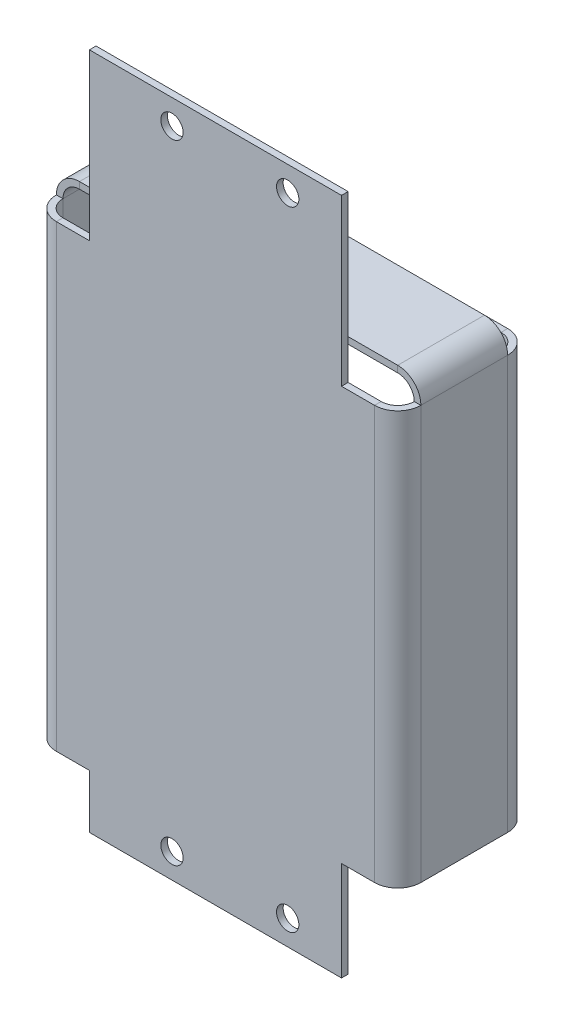
from build123d import *

# Parameters (mm, degrees)
SKETCH1_R                      = 1.35
BASE_FLANGE1_DEPTH             = 0.8
EDGE_FLANGE1_STRIP_W           = 7.2
EDGE_FLANGE1_STRIP_H           = 0.8
EDGE_FLANGE1_STRIP_CUT_DEPTH   = 50
EDGE_FLANGE1_STRIP_2_W         = 7.2
EDGE_FLANGE1_STRIP_2_H         = 0.8
EDGE_FLANGE1_STRIP_CUT_2_DEPTH = 55.5
EDGE_FLANGE1_DEPTH             = 50
EDGE_FLANGE1_BEND_DEPTH        = 55.5
EDGE_FLANGE4_DEPTH             = 10.5
EDGE_FLANGE4_BEND_DEPTH        = 10.5
EDGE_FLANGE5_DEPTH             = 50
EDGE_FLANGE5_BEND_DEPTH        = 55.5


# Sheet-metal steps are written as plain solids
with BuildPart() as part:
    # Sketch1 → Base-Flange1 (new body)
    with BuildSketch(Plane.XY):
        Polygon((15.25, 0), (15.25, -12), (-15.25, -12), (-15.25, -5.5), (-21.25, -5.5), (-21.25, 50), (-15.25, 50), (-15.25, 70), (15.25, 70), (15.25, 50), (21.25, 50), (21.25, 0), align=None)
        with Locations((8.737756115, -9)):
            Circle(SKETCH1_R, mode=Mode.SUBTRACT)
        with Locations((-5.262243885, -9)):
            Circle(SKETCH1_R, mode=Mode.SUBTRACT)
        with Locations((8.737756115, 67)):
            Circle(SKETCH1_R, mode=Mode.SUBTRACT)
        with Locations((-5.262243885, 67)):
            Circle(SKETCH1_R, mode=Mode.SUBTRACT)
    extrude(amount=BASE_FLANGE1_DEPTH)

    # Edge-Flange1 strip (across the edge) → Edge-Flange1 strip cut (cut)
    with BuildSketch(Plane(origin=(21.25, 50, 0), x_dir=(-1, 0, 0), z_dir=(0, -1, 0))):
        with Locations((-1.6, -0.4)):
            Rectangle(EDGE_FLANGE1_STRIP_W, EDGE_FLANGE1_STRIP_H)
    extrude(amount=EDGE_FLANGE1_STRIP_CUT_DEPTH, mode=Mode.SUBTRACT)

    # Edge-Flange1 strip 2 (across the edge) → Edge-Flange1 strip cut 2 (cut)
    with BuildSketch(Plane(origin=(-21.25, -5.5, 0), x_dir=(1, 0, 0), z_dir=(0, 1, 0))):
        with Locations((-1.6, -0.4)):
            Rectangle(EDGE_FLANGE1_STRIP_2_W, EDGE_FLANGE1_STRIP_2_H)
    extrude(amount=EDGE_FLANGE1_STRIP_CUT_2_DEPTH, mode=Mode.SUBTRACT)

    # Edge-Flange1 section (across the edge) → Edge-Flange1 (add)
    with BuildSketch(Plane(origin=(21.25, 50, 0), x_dir=(-1, 0, 0), z_dir=(0, -1, 0))):
        with BuildLine():
            Line((-0.8, 2), (-0.8, 12.5))
            Line((-0.8, 12.5), (0, 12.5))
            Line((0, 12.5), (0, 2))
            ThreePointArc((0, 2), (0.585786438, 0.585786438), (2, 0))
            Line((2, 0), (2, -0.8))
            ThreePointArc((2, -0.8), (0.020101013, 0.020101013), (-0.8, 2))
        make_face()
    extrude(amount=EDGE_FLANGE1_DEPTH)

    # Edge-Flange1 section 2 (across the edge) → Edge-Flange1 bend (add)
    with BuildSketch(Plane(origin=(-21.25, -5.5, 0), x_dir=(1, 0, 0), z_dir=(0, 1, 0))):
        with BuildLine():
            Line((-0.8, 2), (-0.8, 12.5))
            Line((-0.8, 12.5), (0, 12.5))
            Line((0, 12.5), (0, 2))
            ThreePointArc((0, 2), (0.585786438, 0.585786438), (2, 0))
            Line((2, 0), (2, -0.8))
            ThreePointArc((2, -0.8), (0.020101013, 0.020101013), (-0.8, 2))
        make_face()
    extrude(amount=EDGE_FLANGE1_BEND_DEPTH)

    # Edge-Flange4 section (across the edge) → Edge-Flange4 (add)
    with BuildSketch(Plane(origin=(21.25, 52, -2), x_dir=(0, -1, 0), z_dir=(0, 0, -1))):
        with BuildLine():
            Line((-0.8, 2), (-0.8, 20))
            Line((-0.8, 20), (0, 20))
            Line((0, 20), (0, 2))
            ThreePointArc((0, 2), (0.585786438, 0.585786438), (2, 0))
            Line((2, 0), (2, -0.8))
            ThreePointArc((2, -0.8), (0.020101013, 0.020101013), (-0.8, 2))
        make_face()
    extrude(amount=EDGE_FLANGE4_DEPTH)

    # Edge-Flange4 section 2 (across the edge) → Edge-Flange4 bend (add)
    with BuildSketch(Plane(origin=(-21.25, 52, -12.5), x_dir=(0, -1, 0), z_dir=(0, 0, 1))):
        with BuildLine():
            Line((-0.8, 2), (-0.8, 20))
            Line((-0.8, 20), (0, 20))
            Line((0, 20), (0, 2))
            ThreePointArc((0, 2), (0.585786438, 0.585786438), (2, 0))
            Line((2, 0), (2, -0.8))
            ThreePointArc((2, -0.8), (0.020101013, 0.020101013), (-0.8, 2))
        make_face()
    extrude(amount=EDGE_FLANGE4_BEND_DEPTH)

    # Edge-Flange5 section (across the edge) → Edge-Flange5 (add)
    with BuildSketch(Plane(origin=(21.25, 50, -14.5), x_dir=(0, 0, 1), z_dir=(0, -1, 0))):
        with BuildLine():
            Line((-0.8, 2), (-0.8, 10))
            Line((-0.8, 10), (0, 10))
            Line((0, 10), (0, 2))
            ThreePointArc((0, 2), (0.585786438, 0.585786438), (2, 0))
            Line((2, 0), (2, -0.8))
            ThreePointArc((2, -0.8), (0.020101013, 0.020101013), (-0.8, 2))
        make_face()
    extrude(amount=EDGE_FLANGE5_DEPTH)

    # Edge-Flange5 section 2 (across the edge) → Edge-Flange5 bend (add)
    with BuildSketch(Plane(origin=(-21.25, -5.5, -14.5), x_dir=(0, 0, 1), z_dir=(0, 1, 0))):
        with BuildLine():
            Line((-0.8, 2), (-0.8, 10))
            Line((-0.8, 10), (0, 10))
            Line((0, 10), (0, 2))
            ThreePointArc((0, 2), (0.585786438, 0.585786438), (2, 0))
            Line((2, 0), (2, -0.8))
            ThreePointArc((2, -0.8), (0.020101013, 0.020101013), (-0.8, 2))
        make_face()
    extrude(amount=EDGE_FLANGE5_BEND_DEPTH)


solid = part.part
